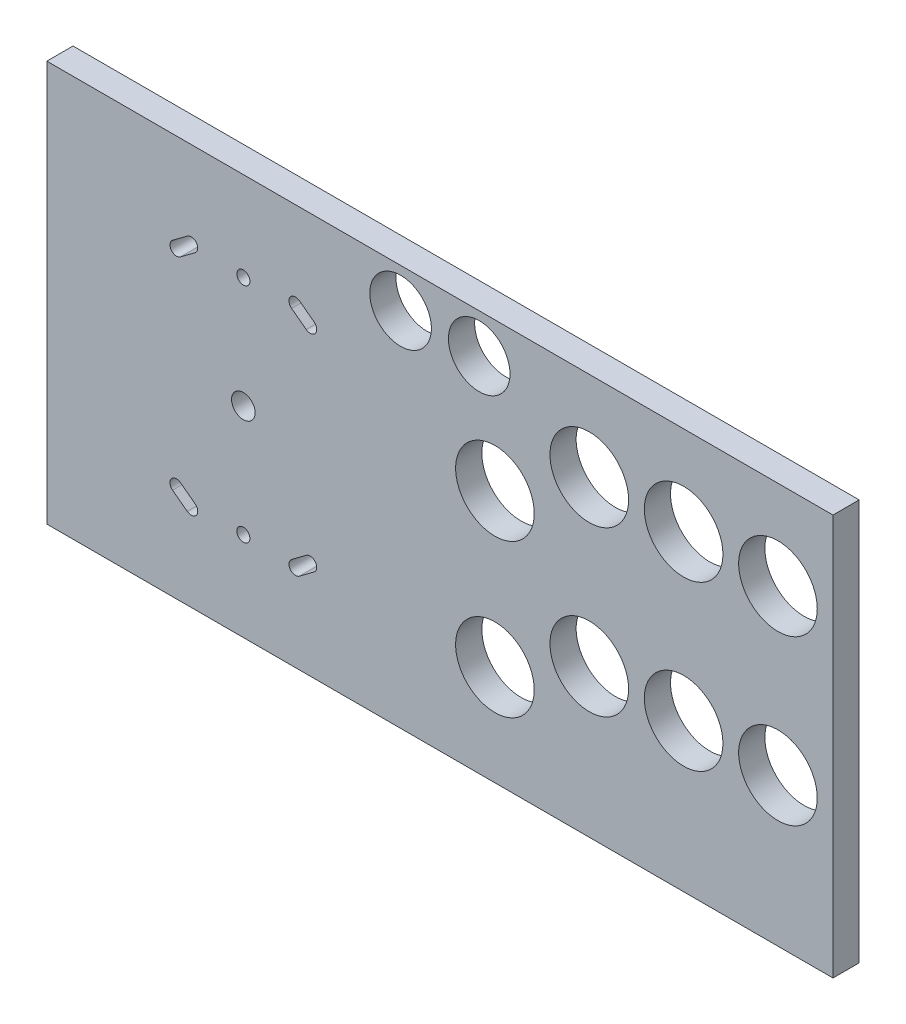
from build123d import *

# Parameters (mm, degrees)
ESQUISSE1_W              = 300
ESQUISSE1_H              = 153
BOSS_EXTRU_1_DEPTH       = 10
ENL_V_MAT_EXTRU_2_DEPTH  = 337.910967468
ESQUISSE5_R              = 4.5
ESQUISSE5_R_2            = 2.5
ENL_V_MAT_EXTRU_3_DEPTH  = 337.910967468
ESQUISSE6_R              = 11.75
ENL_V_MAT_EXTRU_4_DEPTH  = 337.910967468
ESQUISSE7_R              = 15
ENL_V_MAT_EXTRU_5_DEPTH  = 337.910967468
ESQUISSE8_R              = 15
ENL_V_MAT_EXTRU_6_DEPTH  = 337.910967468
ESQUISSE9_R              = 15
ENL_V_MAT_EXTRU_7_DEPTH  = 337.910967468
ESQUISSE10_R             = 15
ENL_V_MAT_EXTRU_8_DEPTH  = 337.910967468
ESQUISSE11_R             = 15
ENL_V_MAT_EXTRU_9_DEPTH  = 337.910967468
ESQUISSE12_R             = 15
ENL_V_MAT_EXTRU_10_DEPTH = 337.910967468
ESQUISSE13_R             = 15
ENL_V_MAT_EXTRU_11_DEPTH = 337.910967468
ESQUISSE14_R             = 15
ENL_V_MAT_EXTRU_12_DEPTH = 337.910967468


with BuildPart() as part:
    # Esquisse1 → Boss.-Extru.1 (new body)
    with BuildSketch(Plane.XY):
        with Locations((150, 76.5)):
            Rectangle(ESQUISSE1_W, ESQUISSE1_H)
    extrude(amount=BOSS_EXTRU_1_DEPTH)

    # Esquisse3 → Enlèv. mat.-Extru.2 (cut, through all)
    with BuildSketch(Plane.XY.offset(10)):
        with BuildLine():
            Line((93.4, 118), (99, 113.8))
            ThreePointArc((99, 113.8), (102.5, 114.3), (102, 117.8))
            Line((102, 117.8), (96.4, 122))
            ThreePointArc((96.4, 122), (92.9, 121.5), (93.4, 118))
        make_face()
        with BuildLine():
            Line((48, 117.8), (53.6, 122))
            ThreePointArc((53.6, 122), (57.1, 121.5), (56.6, 118))
            Line((56.6, 118), (51, 113.8))
            ThreePointArc((51, 113.8), (47.5, 114.3), (48, 117.8))
        make_face()
        with BuildLine():
            Line((48, 35.2), (53.6, 31))
            ThreePointArc((53.6, 31), (57.1, 31.5), (56.6, 35))
            Line((56.6, 35), (51, 39.2))
            ThreePointArc((51, 39.2), (47.5, 38.7), (48, 35.2))
        make_face()
        with BuildLine():
            Line((102, 35.2), (96.4, 31))
            ThreePointArc((96.4, 31), (92.9, 31.5), (93.4, 35))
            Line((93.4, 35), (99, 39.2))
            ThreePointArc((99, 39.2), (102.5, 38.7), (102, 35.2))
        make_face()
    extrude(amount=-ENL_V_MAT_EXTRU_2_DEPTH, mode=Mode.SUBTRACT)

    # Esquisse5 → Enlèv. mat.-Extru.3 (cut, through all)
    with BuildSketch(Plane.XY.offset(10)):
        with Locations((75, 76.5)):
            Circle(ESQUISSE5_R)
        with Locations((75, 119)):
            Circle(ESQUISSE5_R_2)
        with Locations((75, 34)):
            Circle(ESQUISSE5_R_2)
    extrude(amount=-ENL_V_MAT_EXTRU_3_DEPTH, mode=Mode.SUBTRACT)

    # Esquisse6 → Enlèv. mat.-Extru.4 (cut, through all)
    with BuildSketch(Plane.XY.offset(10)):
        with Locations((165, 138)):
            Circle(ESQUISSE6_R)
        with Locations((135, 138)):
            Circle(ESQUISSE6_R)
    extrude(amount=-ENL_V_MAT_EXTRU_4_DEPTH, mode=Mode.SUBTRACT)

    # Esquisse7 → Enlèv. mat.-Extru.5 (cut, through all)
    with BuildSketch(Plane.XY.offset(10)):
        with Locations((171, 96.5)):
            Circle(ESQUISSE7_R)
    extrude(amount=-ENL_V_MAT_EXTRU_5_DEPTH, mode=Mode.SUBTRACT)

    # Esquisse8 → Enlèv. mat.-Extru.6 (cut, through all)
    with BuildSketch(Plane.XY.offset(10)):
        with Locations((207, 119)):
            Circle(ESQUISSE8_R)
    extrude(amount=-ENL_V_MAT_EXTRU_6_DEPTH, mode=Mode.SUBTRACT)

    # Esquisse9 → Enlèv. mat.-Extru.7 (cut, through all)
    with BuildSketch(Plane.XY.offset(10)):
        with Locations((243, 119)):
            Circle(ESQUISSE9_R)
    extrude(amount=-ENL_V_MAT_EXTRU_7_DEPTH, mode=Mode.SUBTRACT)

    # Esquisse10 → Enlèv. mat.-Extru.8 (cut, through all)
    with BuildSketch(Plane.XY.offset(10)):
        with Locations((279, 119)):
            Circle(ESQUISSE10_R)
    extrude(amount=-ENL_V_MAT_EXTRU_8_DEPTH, mode=Mode.SUBTRACT)

    # Esquisse11 → Enlèv. mat.-Extru.9 (cut, through all)
    with BuildSketch(Plane.XY.offset(10)):
        with Locations((171, 38.2)):
            Circle(ESQUISSE11_R)
    extrude(amount=-ENL_V_MAT_EXTRU_9_DEPTH, mode=Mode.SUBTRACT)

    # Esquisse12 → Enlèv. mat.-Extru.10 (cut, through all)
    with BuildSketch(Plane.XY.offset(10)):
        with Locations((207, 56.5)):
            Circle(ESQUISSE12_R)
    extrude(amount=-ENL_V_MAT_EXTRU_10_DEPTH, mode=Mode.SUBTRACT)

    # Esquisse13 → Enlèv. mat.-Extru.11 (cut, through all)
    with BuildSketch(Plane.XY.offset(10)):
        with Locations((243, 56.5)):
            Circle(ESQUISSE13_R)
    extrude(amount=-ENL_V_MAT_EXTRU_11_DEPTH, mode=Mode.SUBTRACT)

    # Esquisse14 → Enlèv. mat.-Extru.12 (cut, through all)
    with BuildSketch(Plane.XY.offset(10)):
        with Locations((279, 56.5)):
            Circle(ESQUISSE14_R)
    extrude(amount=-ENL_V_MAT_EXTRU_12_DEPTH, mode=Mode.SUBTRACT)


solid = part.part
